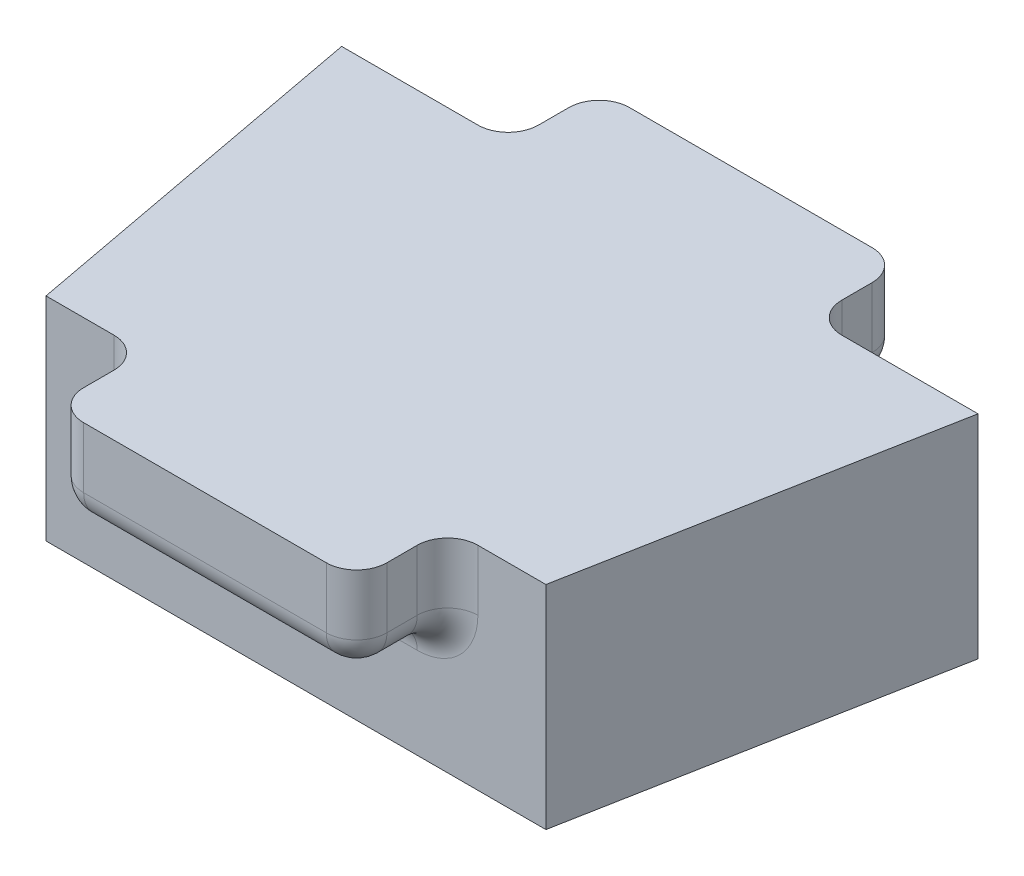
from build123d import *

# Parameters (mm, degrees)
BOSS_EXTRUDE1_DEPTH = 6
BOSS_EXTRUDE2_DEPTH = 1
SKETCH3_W           = 10
SKETCH3_H           = 3
BOSS_EXTRUDE3_DEPTH = 3
FILLET1_R           = 1


with BuildPart() as part:
    # Sketch1 → Boss-Extrude1 (new body)
    with BuildSketch(Plane(origin=(0, 0, 0), x_dir=(1, 0, 0), z_dir=(0, 1, 0))):
        Polygon((-10.492426287, 6), (10.492426287, 6), (8.242426287, -6), (-8.242426287, -6), align=None)
        Polygon((-9.1, 4), (9.1, 4), (7.6, -4), (-7.6, -4), align=None, mode=Mode.SUBTRACT)
    extrude(amount=BOSS_EXTRUDE1_DEPTH)

    # Sketch2 → Boss-Extrude2 (add)
    with BuildSketch(Plane(origin=(0, 6, 0), x_dir=(1, 0, 0), z_dir=(0, 1, 0))):
        Polygon((-10.492426287, 6), (-8.242426287, -6), (8.242426287, -6), (10.492426287, 6), align=None)
    extrude(amount=BOSS_EXTRUDE2_DEPTH)

    # Sketch3 → Boss-Extrude3 (add)
    with BuildSketch(Plane(origin=(0, 7, 0), x_dir=(1, 0, 0), z_dir=(0, 1, 0))):
        with Locations((0, 7.5)):
            Rectangle(SKETCH3_W, SKETCH3_H)
        with Locations((0, -7.5)):
            Rectangle(SKETCH3_W, SKETCH3_H)
    extrude(amount=-BOSS_EXTRUDE3_DEPTH)

    # Fillet1
    fillet1_edges = [part.edges().sort_by_distance(p)[0] for p in [
        (-5, 5.5, 9),
        (-5, 4, 7.5),
        (5, 4, 7.5),
        (5, 5.5, 9),
        (5, 5.5, -9),
        (5, 4, -7.5),
        (-5, 4, -7.5),
        (-5, 5.5, -9),
        (0, 4, -9),
        (0, 4, 9),
        (-5, 5.5, 6),
        (5, 5.5, 6),
        (0, 4, 6),
        (5, 5.5, -6),
        (-5, 5.5, -6),
        (0, 4, -6),
    ]]
    fillet(fillet1_edges, radius=FILLET1_R)


solid = part.part
